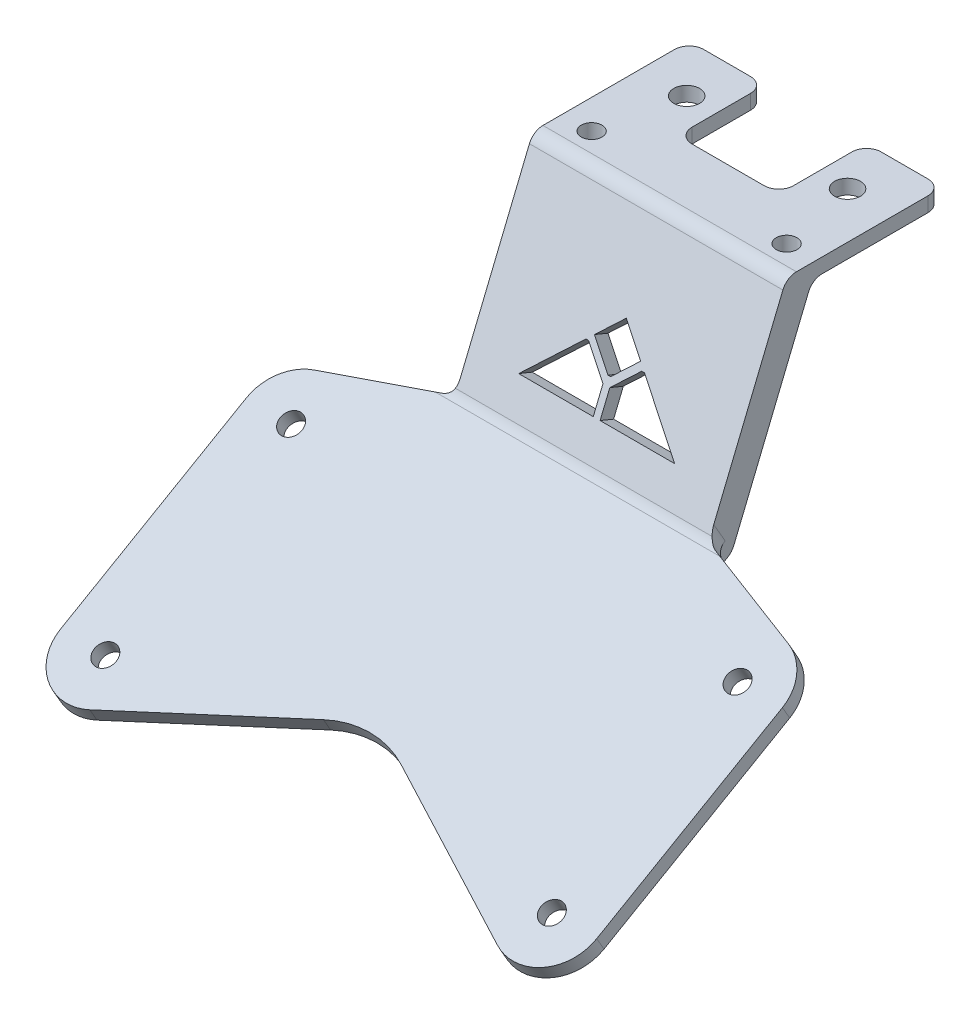
from build123d import *

# Parameters (mm, degrees)
BOSS_EXTRUDE1_DEPTH      = 4.7625
BOSS_EXTRUDE2_DEPTH      = 41.275
BOSS_EXTRUDE4_START      = 41.275
BOSS_EXTRUDE4_DEPTH      = 4.7625
BOSS_EXTRUDE5_START      = -41.275
BOSS_EXTRUDE5_DEPTH      = 4.7625
BOSS_EXTRUDE3_DEPTH      = 4.7625
CUT_EXTRUDE1_DEPTH       = 197.1201289744139
FILLET3_R                = 4.7625
FILLET5_R                = 29.209999999999997
F_1_4_CLEARANCE_HOLE1_D  = 6.7564
F_5_16_CLEARANCE_HOLE1_D = 8.4328
F_1_4_CLEARANCE_HOLE2_D  = 7.14248
FILLET6_R                = 2.3812499999999996


with BuildPart() as part:
    # Sketch1 → Boss-Extrude1 (new body)
    with BuildSketch(Plane(origin=(0, 0, 0), x_dir=(1, 0, 0), z_dir=(0, 1, 0))):
        Polygon((41.275, -25.39999999999999), (-41.275, -25.400000000000002), (-41.275, 25.4), (-16.510000000000005, 25.4), (-16.509999999999998, -3.1750000000000003), (16.509999999999998, -3.1749999999999963), (16.509999999999998, 25.400000000000002), (41.275, 25.400000000000006), align=None)
    extrude(amount=BOSS_EXTRUDE1_DEPTH)

    # Sketch6 → Boss-Extrude2 (add, symmetric)
    with BuildSketch(Plane(origin=(0, 0, 0), x_dir=(0, 0, -1), z_dir=(1, 0, 0))):
        Polygon((-22.20613588199718, 0), (-47.01090584437518, -60.46162678329637), (-59.41727262806233, -67.62444598552347), (-61.79852262806233, -63.50000000000006), (-50.8, -57.15), (-25.39999999999999, 4.7625), (-25.39999999999999, 0), align=None)
    extrude(amount=BOSS_EXTRUDE2_DEPTH, both=True)

    # Sketch10 → Boss-Extrude4 (add)
    with BuildSketch(Plane(origin=(0, 0, 0), x_dir=(0, 0, -1), z_dir=(1, 0, 0)).offset(BOSS_EXTRUDE4_START)):
        Polygon((-17.05842561014821, 0), (-43.22181168875039, -63.77325356659284), (-79.03306788418706, -84.44889197104685), (-81.41431788418706, -80.32444598552347), (-47.01090584437518, -60.46162678329637), (-22.20613588199718, 0), align=None)
    extrude(amount=-BOSS_EXTRUDE4_DEPTH)

    # Sketch10<2> → Boss-Extrude5 (add)
    with BuildSketch(Plane(origin=(0, 0, 0), x_dir=(0, 0, -1), z_dir=(1, 0, 0)).offset(BOSS_EXTRUDE5_START)):
        Polygon((-17.05842561014821, 0), (-43.22181168875039, -63.77325356659284), (-79.03306788418706, -84.44889197104685), (-81.41431788418706, -80.32444598552347), (-47.01090584437518, -60.46162678329637), (-22.20613588199718, 0), align=None)
    extrude(amount=BOSS_EXTRUDE5_DEPTH)

    # Sketch7 → Boss-Extrude3 (add)
    with BuildSketch(Plane(origin=(0, -20.865454743874867, -12.046675913140254), x_dir=(1, 0, 0), z_dir=(0, 0.866025403784436, 0.5000000000000046))):
        with BuildLine():
            Line((-87.3125, -167.81909051224963), (-87.31250000000001, -97.96909051224961))
            ThreePointArc((-87.31250000000001, -97.96909051224961), (-84.50480271700945, -89.35923141913764), (-77.16122665481106, -84.05972877692089))
            Line((-77.16122665481106, -84.05972877692089), (-41.275, -72.5690905122496))
            Line((-41.275, -72.5690905122496), (41.275, -72.5690905122496))
            Line((41.275, -72.5690905122496), (77.16122665481105, -84.0597287769209))
            ThreePointArc((77.16122665481105, -84.0597287769209), (84.50480271700943, -89.35923141913766), (87.31250000000001, -97.96909051224961))
            Line((87.31250000000001, -97.96909051224961), (87.31250000000001, -167.81909051224963))
            ThreePointArc((87.31250000000001, -167.81909051224963), (80.4839803351822, -180.18162983863905), (66.38372511516263, -180.98404004522925))
            Line((66.38372511516263, -180.98404004522925), (0, -149.09666116895025))
            Line((0, -149.09666116895025), (-66.38372511516263, -180.98404004522925))
            ThreePointArc((-66.38372511516263, -180.98404004522925), (-80.48398033518218, -180.18162983863903), (-87.3125, -167.81909051224963))
        make_face()
    extrude(amount=-BOSS_EXTRUDE3_DEPTH)

    # Sketch11 → Cut-Extrude1 (cut, through all)
    with BuildSketch(Plane(origin=(0, 9.605402363534044, 23.413168261114233), x_dir=(1, 0, 0), z_dir=(0, 0.37955635625630607, 0.9251686183747458))):
        Polygon((-25.400000388402205, -59.45484943793708), (-9.52500014565082, -43.57984943793708), (-8.657059559184285, -43.57984943793708), (-1.1112499999999998, -51.12565911250755), (-1.1112499999999998, -59.45484943793708), align=None)
        Polygon((1.1112499999999998, -59.45484943793708), (25.399999611597792, -59.45484943793708), (9.524999854349167, -43.57984943793708), (8.657059789956651, -43.57984943793708), (1.1112499999999998, -51.12565911250755), align=None)
        Polygon((0.4339700458708439, -48.65984943793709), (7.519485019617413, -41.57433457253814), (0, -34.05484943793708), (-7.519485012578843, -41.574334335532285), (-0.43397001852167266, -48.65984943793709), align=None)
    extrude(amount=-CUT_EXTRUDE1_DEPTH, mode=Mode.SUBTRACT)

    # Fillet3
    fillet3_edges = [part.edges().sort_by_distance(p)[0] for p in [
        (-41.275, 2.38125, -25.4),
    ]]
    fillet(fillet3_edges, radius=FILLET3_R)
    fillet3_2_edges = [part.edges().sort_by_distance(p)[0] for p in [
        (-41.275, -59.21222299276168, 49.60937499999998),
    ]]
    fillet(fillet3_2_edges, radius=FILLET3_R)
    fillet3_3_edges = [part.edges().sort_by_distance(p)[0] for p in [
        (-16.510000000000005, 2.38125, -25.4),
    ]]
    fillet(fillet3_3_edges, radius=FILLET3_R)
    fillet3_4_edges = [part.edges().sort_by_distance(p)[0] for p in [
        (-38.89375, 0, 17.05842561014821),
    ]]
    fillet(fillet3_4_edges, radius=FILLET3_R)
    fillet3_5_edges = [part.edges().sort_by_distance(p)[0] for p in [
        (0, 0, 22.20613588199718),
    ]]
    fillet(fillet3_5_edges, radius=FILLET3_R)
    fillet3_6_edges = [part.edges().sort_by_distance(p)[0] for p in [
        (38.89375, 0, 17.05842561014821),
    ]]
    fillet(fillet3_6_edges, radius=FILLET3_R)
    fillet3_7_edges = [part.edges().sort_by_distance(p)[0] for p in [
        (-38.89375, -63.77325356659284, 43.22181168875039),
    ]]
    fillet(fillet3_7_edges, radius=FILLET3_R)
    fillet3_8_edges = [part.edges().sort_by_distance(p)[0] for p in [
        (0, -60.46162678329637, 47.01090584437518),
    ]]
    fillet(fillet3_8_edges, radius=FILLET3_R)
    fillet3_9_edges = [part.edges().sort_by_distance(p)[0] for p in [
        (-0.7533233620346138, -57.15, 50.8),
    ]]
    fillet(fillet3_9_edges, radius=FILLET3_R)
    fillet3_10_edges = [part.edges().sort_by_distance(p)[0] for p in [
        (0, 4.7625, 25.4),
    ]]
    fillet(fillet3_10_edges, radius=FILLET3_R)
    fillet3_11_edges = [part.edges().sort_by_distance(p)[0] for p in [
        (-16.509999999999998, 2.38125, 3.1750000000000003),
    ]]
    fillet(fillet3_11_edges, radius=FILLET3_R)
    fillet3_12_edges = [part.edges().sort_by_distance(p)[0] for p in [
        (16.509999999999998, 2.38125, 3.1749999999999963),
    ]]
    fillet(fillet3_12_edges, radius=FILLET3_R)
    fillet3_13_edges = [part.edges().sort_by_distance(p)[0] for p in [
        (16.509999999999998, 2.38125, -25.400000000000002),
    ]]
    fillet(fillet3_13_edges, radius=FILLET3_R)
    fillet3_14_edges = [part.edges().sort_by_distance(p)[0] for p in [
        (38.89375, -63.77325356659284, 43.22181168875039),
    ]]
    fillet(fillet3_14_edges, radius=FILLET3_R)
    fillet3_15_edges = [part.edges().sort_by_distance(p)[0] for p in [
        (41.275, 2.38125, -25.400000000000006),
    ]]
    fillet(fillet3_15_edges, radius=FILLET3_R)
    fillet3_16_edges = [part.edges().sort_by_distance(p)[0] for p in [
        (41.275, -59.0883646148863, 49.68088466780772),
    ]]
    fillet(fillet3_16_edges, radius=FILLET3_R)

    # Fillet5
    fillet5_edges = [part.edges().sort_by_distance(p)[0] for p in [
        (0, -97.47600832111236, 115.88419527861113),
    ]]
    fillet(fillet5_edges, radius=FILLET5_R)

    # 1/4 Clearance Hole1 (through all)
    with Locations(Plane(origin=(0, 4.7625, 0), x_dir=(1, 0, 0), z_dir=(0, 1, 0))):
        with Locations((-31.75, -15.875), (31.75, -15.875)):
            Hole(F_1_4_CLEARANCE_HOLE1_D / 2)

    # 5/16 Clearance Hole1 (through all)
    with Locations(Plane(origin=(0, 4.7625, 0), x_dir=(1, 0, 0), z_dir=(0, 1, 0))):
        with Locations((-26.19375, 9.525), (26.19375, 9.525)):
            Hole(F_5_16_CLEARANCE_HOLE1_D / 2)

    # 1/4 Clearance Hole2 (through all)
    with Locations(Plane(origin=(0, -20.865454743874867, -12.046675913140254), x_dir=(1, 0, 0), z_dir=(0, 0.866025403784436, 0.5000000000000046))):
        with Locations((-72.7075, -97.969090512), (-72.7075, -167.819090512), (72.7075, -167.819090512), (72.7075, -97.969090512)):
            Hole(F_1_4_CLEARANCE_HOLE2_D / 2)

    # Fillet6
    fillet6_edges = [part.edges().sort_by_distance(p)[0] for p in [
        (38.89375, -84.44889197104685, 79.03306788418706),
        (-38.89375, -84.44889197104685, 79.03306788418706),
    ]]
    fillet(fillet6_edges, radius=FILLET6_R)


solid = part.part
